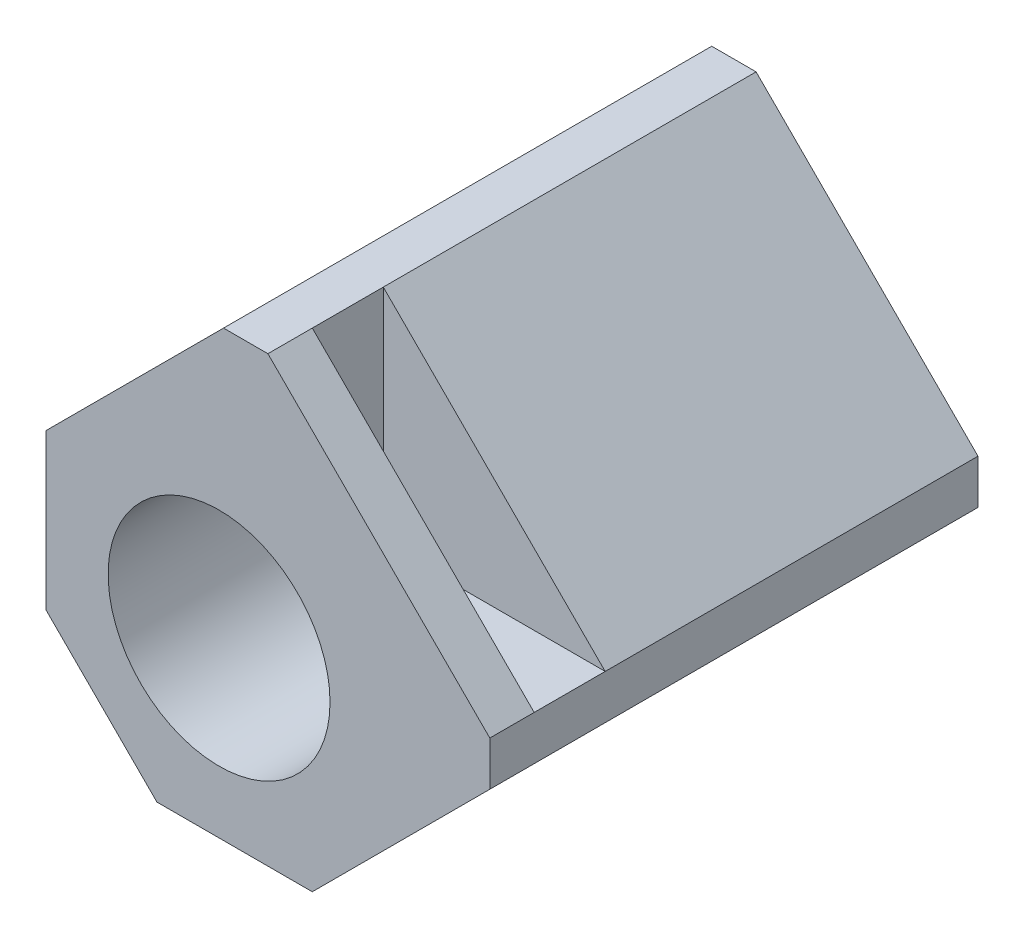
from build123d import *

# Parameters (mm, degrees)
ESQUISSE1_W             = 20
ESQUISSE1_H             = 20
BOSS_EXTRU_1_DEPTH      = 22
CHANFREIN1_SIZE         = 10
ENL_V_START             = -2
ENL_V_MAT_EXTRU_1_DEPTH = 3.2
ESQUISSE3_R             = 2.2
ENL_V_MAT_EXTRU_2_DEPTH = 36.832945734
ESQUISSE4_R             = 5
ENL_V_MAT_EXTRU_3_DEPTH = 10.5
CHANFREIN2_SIZE         = 5
CHANFREIN3_SIZE         = 8


with BuildPart() as part:
    # Esquisse1 → Boss.-Extru.1 (new body)
    with BuildSketch(Plane.XY):
        with Locations((10, 10)):
            Rectangle(ESQUISSE1_W, ESQUISSE1_H)
    extrude(amount=BOSS_EXTRU_1_DEPTH)

    # Chanfrein1
    chanfrein1_edges = [part.edges().sort_by_distance(p)[0] for p in [
        (20, 20, 11),
    ]]
    chamfer(chanfrein1_edges, length=CHANFREIN1_SIZE)

    # Esquisse2 → Enlèv. mat.-Extru.1 (cut)
    with BuildSketch(Plane.XY.offset(22).offset(ENL_V_START)):
        Polygon((10, 20), (10, 10), (20, 10), align=None)
    extrude(amount=-ENL_V_MAT_EXTRU_1_DEPTH, mode=Mode.SUBTRACT)

    # Esquisse3 → Enlèv. mat.-Extru.2 (cut, through all)
    with BuildSketch(Plane(origin=(0, 0, 0), x_dir=(-1, 0, 0), z_dir=(0, 0, -1))):
        with Locations((-7.8, 7.8)):
            Circle(ESQUISSE3_R)
    extrude(amount=-ENL_V_MAT_EXTRU_2_DEPTH, mode=Mode.SUBTRACT)

    # Esquisse4 → Enlèv. mat.-Extru.3 (cut)
    with BuildSketch(Plane.XY.offset(22)):
        with Locations((7.8, 7.8)):
            Circle(ESQUISSE4_R)
    extrude(amount=-ENL_V_MAT_EXTRU_3_DEPTH, mode=Mode.SUBTRACT)

    # Chanfrein2
    chanfrein2_edges = [part.edges().sort_by_distance(p)[0] for p in [
        (0, 0, 11),
    ]]
    chamfer(chanfrein2_edges, length=CHANFREIN2_SIZE)

    # Chanfrein3
    chanfrein3_edges = [part.edges().sort_by_distance(p)[0] for p in [
        (20, 0, 11),
        (0, 20, 11),
    ]]
    chamfer(chanfrein3_edges, length=CHANFREIN3_SIZE)


solid = part.part
